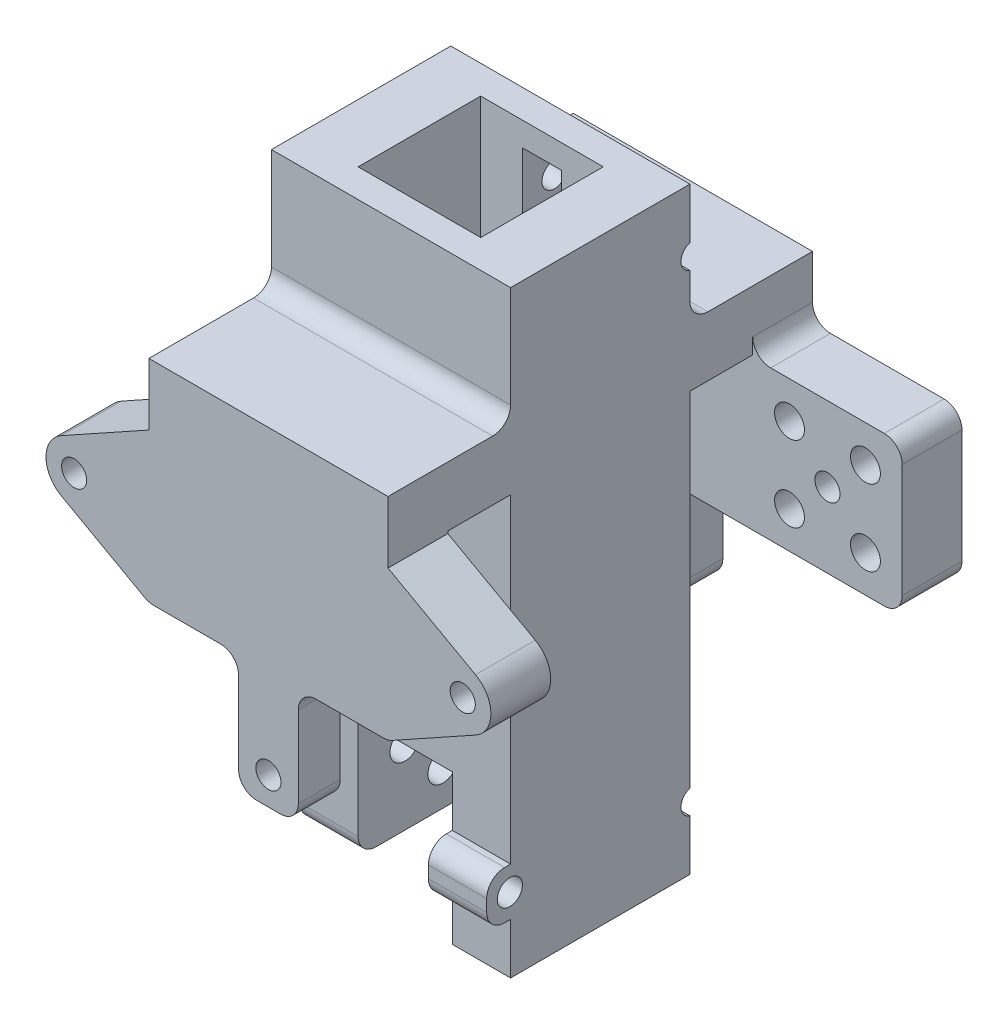
from build123d import *

# Parameters (mm, degrees)
SKETCH2_W           = 40
SKETCH2_H           = 30
BOSS_EXTRUDE1_DEPTH = 100
SKETCH3_W           = 20.5
SKETCH3_H           = 20.5
CUT_EXTRUDE1_DEPTH  = 100
SKETCH4_W           = 20.5
SKETCH4_H           = 50
CUT_EXTRUDE2_DEPTH  = 4.75
SKETCH5_W           = 4.75
SKETCH5_H           = 25
CUT_EXTRUDE4_DEPTH  = 9.75
SKETCH6_R           = 2.1
CUT_EXTRUDE5_DEPTH  = 9.75
SKETCH7_R           = 2.5
CUT_EXTRUDE6_DEPTH  = 5.18
SKETCH8_W           = 40
SKETCH8_H           = 10
BOSS_EXTRUDE2_DEPTH = 20.5
SKETCH9_W           = 40
SKETCH9_H           = 10
BOSS_EXTRUDE3_DEPTH = 45
BOSS_EXTRUDE4_START = -65
SKETCH11_W          = 10
SKETCH11_H          = 25
BOSS_EXTRUDE4_DEPTH = 90
SKETCH13_R          = 2.1
CUT_EXTRUDE7_DEPTH  = 4.57
CUT_EXTRUDE8_START  = -5.43
SKETCH14_R          = 2.1
SKETCH14_R_2        = 2.5
CUT_EXTRUDE8_DEPTH  = 5.43
SKETCH15_R          = 2.1
CUT_EXTRUDE9_DEPTH  = 10
CUT_EXTRUDE10_REACH = 132.637
SKETCH18_R          = 2.1
SKETCH19_W          = 15
SKETCH19_H          = 19.625
CUT_EXTRUDE11_DEPTH = 12.57
FILLET1_R           = 3
SKETCH20_W          = 11.314866833
SKETCH20_H          = 26.234404623
CUT_EXTRUDE12_DEPTH = 3
SKETCH22_W          = 9.75
SKETCH22_H          = 8
BOSS_EXTRUDE5_DEPTH = 4
SKETCH21_R          = 2.1
CUT_EXTRUDE13_DEPTH = 40
FILLET2_R           = 3
SKETCH23_W          = 6.5
SKETCH23_H          = 13
CUT_EXTRUDE14_DEPTH = 4.75
SKETCH25_R          = 3.1
SKETCH25_R_2        = 2.1
BOSS_EXTRUDE7_DEPTH = 4
SKETCH25_3_R        = 2.1
CUT_EXTRUDE16_DEPTH = 16.75


with BuildPart() as part:
    # Sketch2 → Boss-Extrude1 (new body)
    with BuildSketch(Plane(origin=(0, 0, 0), x_dir=(1, 0, 0), z_dir=(0, 1, 0))):
        Rectangle(SKETCH2_W, SKETCH2_H)
    extrude(amount=BOSS_EXTRUDE1_DEPTH)

    # Sketch3 → Cut-Extrude1 (cut)
    with BuildSketch(Plane(origin=(0, 0, 0), x_dir=(1, 0, 0), z_dir=(0, 1, 0))):
        Rectangle(SKETCH3_W, SKETCH3_H)
    extrude(amount=CUT_EXTRUDE1_DEPTH, mode=Mode.SUBTRACT)

    # Sketch4 → Cut-Extrude2 (cut)
    with BuildSketch(Plane.XY.offset(15)):
        Rectangle(SKETCH4_W, SKETCH4_H)
    extrude(amount=-CUT_EXTRUDE2_DEPTH, mode=Mode.SUBTRACT)

    # Sketch5 → Cut-Extrude4 (cut)
    with BuildSketch(Plane(origin=(-10.25, 0, 0), x_dir=(0, 0, -1), z_dir=(1, 0, 0))):
        with Locations((-12.625, 12.5)):
            Rectangle(SKETCH5_W, SKETCH5_H)
    extrude(amount=-CUT_EXTRUDE4_DEPTH, mode=Mode.SUBTRACT)

    # Sketch6 → Cut-Extrude5 (cut)
    with BuildSketch(Plane.ZY.offset(20)):
        with Locations((2.425, 12.5)):
            Circle(SKETCH6_R)
        with Locations((-10.275, 12.5)):
            Circle(SKETCH6_R)
        with Locations((-3.925, 18.85)):
            Circle(SKETCH6_R)
        with Locations((-3.925, 6.15)):
            Circle(SKETCH6_R)
    extrude(amount=-CUT_EXTRUDE5_DEPTH, mode=Mode.SUBTRACT)

    # Sketch7 → Cut-Extrude6 (cut)
    with BuildSketch(Plane(origin=(-10.25, 0, 0), x_dir=(0, 0, -1), z_dir=(1, 0, 0))):
        with Locations((-2.425, 12.5)):
            Circle(SKETCH7_R)
        with Locations((10.275, 12.5)):
            Circle(SKETCH7_R)
        with Locations((3.925, 18.85)):
            Circle(SKETCH7_R)
        with Locations((3.925, 6.15)):
            Circle(SKETCH7_R)
    extrude(amount=-CUT_EXTRUDE6_DEPTH, mode=Mode.SUBTRACT)

    # Sketch8 → Boss-Extrude2 (add)
    with BuildSketch(Plane(origin=(0, 0, -15), x_dir=(-1, 0, 0), z_dir=(0, 0, -1))):
        with Locations((0, 75)):
            Rectangle(SKETCH8_W, SKETCH8_H)
    boss_extrude2 = extrude(amount=BOSS_EXTRUDE2_DEPTH)

    # Sketch9 → Boss-Extrude3 (add)
    with BuildSketch(Plane.XZ.offset(-70)):
        with Locations((0, -30.5)):
            Rectangle(SKETCH9_W, SKETCH9_H)
    boss_extrude3 = extrude(amount=BOSS_EXTRUDE3_DEPTH)

    # Sketch11 → Boss-Extrude4 (add)
    with BuildSketch(Plane(origin=(20, 0, 0), x_dir=(0, 0, -1), z_dir=(1, 0, 0)).offset(BOSS_EXTRUDE4_START)):
        with Locations((30.5, 57.125)):
            Rectangle(SKETCH11_W, SKETCH11_H)
    boss_extrude4 = extrude(amount=BOSS_EXTRUDE4_DEPTH)

    # Sketch13 → Cut-Extrude7 (cut)
    with BuildSketch(Plane(origin=(0, 0, -35.5), x_dir=(-1, 0, 0), z_dir=(0, 0, -1))):
        with Locations((-32.5, 57.125)):
            Circle(SKETCH13_R)
        with Locations((-26.15, 63.475)):
            Circle(SKETCH13_R)
        with Locations((-38.85, 63.475)):
            Circle(SKETCH13_R)
        with Locations((-38.85, 50.775)):
            Circle(SKETCH13_R)
        with Locations((-26.15, 50.775)):
            Circle(SKETCH13_R)
    extrude(amount=-CUT_EXTRUDE7_DEPTH, mode=Mode.SUBTRACT)

    # Sketch14 → Cut-Extrude8 (cut)
    with BuildSketch(Plane.XY.offset(-25.5).offset(CUT_EXTRUDE8_START)):
        with Locations(Location((32.5, 57.125, 0), (0, 0, 180))):
            Circle(SKETCH14_R)
        with Locations((38.85, 63.475)):
            Circle(SKETCH14_R_2)
        with Locations((26.15, 63.475)):
            Circle(SKETCH14_R_2)
        with Locations((26.15, 50.775)):
            Circle(SKETCH14_R_2)
        with Locations((38.85, 50.775)):
            Circle(SKETCH14_R_2)
    extrude(amount=CUT_EXTRUDE8_DEPTH, mode=Mode.SUBTRACT)

    # Sketch15 → Cut-Extrude9 (cut)
    with BuildSketch(Plane(origin=(0, 0, -35.5), x_dir=(-1, 0, 0), z_dir=(0, 0, -1))):
        with Locations((32.5, 57.125)):
            Circle(SKETCH15_R)
        with Locations((0, 29.65)):
            Circle(SKETCH15_R)
        with BuildLine():
            Line((20, 69.625), (34.632584515, 61.495786381))
            ThreePointArc((34.632584515, 61.495786381), (37.204369859, 57.125), (34.632584515, 52.754213619))
            Line((34.632584515, 52.754213619), (20, 44.625))
            Line((20, 44.625), (45, 44.625))
            Line((45, 44.625), (45, 69.625))
            Line((45, 69.625), (20, 69.625))
        make_face()
    cut_extrude9 = extrude(amount=-CUT_EXTRUDE9_DEPTH, mode=Mode.SUBTRACT)

    # Mirror2: Boss-Extrude2, Boss-Extrude3, Boss-Extrude4, Cut-Extrude9 across plane
    add(boss_extrude2.mirror(Plane.XY))
    add(boss_extrude3.mirror(Plane.XY))
    add(boss_extrude4.mirror(Plane.XY))
    add(cut_extrude9.mirror(Plane.XY), mode=Mode.SUBTRACT)

    # Sketch18 → Cut-Extrude10 (cut, up to next)
    with BuildSketch(Plane.XY.offset(35.5), mode=Mode.PRIVATE) as cut_extrude10_sk1:
        with BuildLine():
            Line((20, 69.625), (34.632584515, 61.495786381))
            ThreePointArc((34.632584515, 61.495786381), (37.204369859, 57.125), (34.632584515, 52.754213619))
            Line((34.632584515, 52.754213619), (20, 44.625))
            Line((20, 44.625), (45, 44.625))
            Line((45, 44.625), (45, 69.625))
            Line((45, 69.625), (20, 69.625))
        make_face()
    cut_extrude10_tool1 = extrude(cut_extrude10_sk1.sketch, amount=-CUT_EXTRUDE10_REACH, mode=Mode.PRIVATE) & part.part
    # Sketch18 → Cut-Extrude10 (cut, up to next)
    with BuildSketch(Plane.XY.offset(35.5), mode=Mode.PRIVATE) as cut_extrude10_sk2:
        with Locations(Location((32.5, 57.125, 0), (0, 0, 180))):
            Circle(SKETCH18_R)
    cut_extrude10_tool2 = extrude(cut_extrude10_sk2.sketch, amount=-CUT_EXTRUDE10_REACH, mode=Mode.PRIVATE) & part.part
    add(cut_extrude10_tool1.solids().sort_by_distance((27.487993, 65.869454, 35.5))[0], mode=Mode.SUBTRACT)
    add(cut_extrude10_tool2.solids().sort_by_distance((32.5, 57.125, 35.5))[0], mode=Mode.SUBTRACT)

    # Sketch19 → Cut-Extrude11 (cut)
    with BuildSketch(Plane.XY.offset(35.5)):
        with Locations((-12.5, 34.8125)):
            Rectangle(SKETCH19_W, SKETCH19_H)
        with Locations((12.5, 34.8125)):
            Rectangle(SKETCH19_W, SKETCH19_H)
    cut_extrude11 = extrude(amount=-CUT_EXTRUDE11_DEPTH, mode=Mode.SUBTRACT)

    # Mirror3: Cut-Extrude11 across plane
    add(cut_extrude11.mirror(Plane.XY), mode=Mode.SUBTRACT)

    # Fillet1
    # the kernel refuses this fillet: 3 mm, written as the material it adds along each edge
    with BuildSketch(Plane(origin=(-20, 80, -15), x_dir=(0, 1, 0), z_dir=(1, 0, 0)), Plane(origin=(-20, 80, 15), x_dir=(0, 0, 1), z_dir=(1, 0, 0))) as fillet1_piece_1:
        with BuildLine():
            CenterArc((FILLET1_R, -FILLET1_R), FILLET1_R, 90, 90)
            Line((0, -FILLET1_R), (0, 0))
            Line((0, 0), (FILLET1_R, 0))
        make_face()
    extrude(amount=40)
    with BuildSketch(Plane(origin=(20, 69.625, -35.5), x_dir=(1, 0, 0), z_dir=(0, 0, 1)), Plane(origin=(-5, 44.625, 35.5), x_dir=(0, -1, 0), z_dir=(0, 0, -1)), Plane(origin=(5, 44.625, 35.5), x_dir=(1, 0, 0), z_dir=(0, 0, -1)), Plane(origin=(-5, 44.625, -35.5), x_dir=(-1, 0, 0), z_dir=(0, 0, 1)), Plane(origin=(5, 44.625, -35.5), x_dir=(0, -1, 0), z_dir=(0, 0, 1))) as fillet1_piece_2:
        with BuildLine():
            CenterArc((FILLET1_R, FILLET1_R), FILLET1_R, 180, 90)
            Line((0, FILLET1_R), (0, 0))
            Line((0, 0), (FILLET1_R, 0))
        make_face()
    extrude(amount=10)
    # the kernel refuses this fillet: 3 mm, written as the material it takes off along each edge
    with BuildSketch(Plane(origin=(-20, 44.625, -37.443445211), x_dir=(1, 0, 0), z_dir=(0, 0, 1)), Plane(origin=(-20, 44.625, 37.443445211), x_dir=(-0.8741572761215363, 0.48564293117863483, 0), z_dir=(0, 0, -1))) as fillet1_2_piece_1:
        with BuildLine():
            CenterArc((FILLET1_R * 0.259126028197, FILLET1_R), FILLET1_R, 240.945395901, 29.054604099)
            Line((-FILLET1_R * 0.226516902981, FILLET1_R * 0.125842723878), (0, 0))
            Line((0, 0), (FILLET1_R * 0.259126028197, 0))
        make_face()
    extrude(amount=13.886890423, mode=Mode.SUBTRACT)
    with BuildSketch(Plane(origin=(45, 44.625, -43), x_dir=(0, 1, 0), z_dir=(0, 0, 1)), Plane(origin=(5, 25, 43), x_dir=(-1, 0, 0), z_dir=(0, 0, -1)), Plane(origin=(-5, 25, 43), x_dir=(0, 1, 0), z_dir=(0, 0, -1)), Plane(origin=(5, 25, -43), x_dir=(0, 1, 0), z_dir=(0, 0, 1)), Plane(origin=(-5, 25, -43), x_dir=(1, 0, 0), z_dir=(0, 0, 1))) as fillet1_2_piece_2:
        with BuildLine():
            CenterArc((FILLET1_R, FILLET1_R), FILLET1_R, 180, 90)
            Line((0, FILLET1_R), (0, 0))
            Line((0, 0), (FILLET1_R, 0))
        make_face()
    extrude(amount=25, mode=Mode.SUBTRACT)
    with BuildSketch(Plane(origin=(45, 69.625, -18), x_dir=(-1, 0, 0), z_dir=(0, 0, -1))) as fillet1_2_piece_3:
        with BuildLine():
            CenterArc((FILLET1_R, -FILLET1_R), FILLET1_R, 90, 90)
            Line((0, -FILLET1_R), (0, 0))
            Line((0, 0), (FILLET1_R, 0))
        make_face()
    extrude(amount=25, mode=Mode.SUBTRACT)
    with BuildSketch(Plane(origin=(20, 44.625, 23.556554789), x_dir=(-1, 0, 0), z_dir=(0, 0, 1))) as fillet1_2_piece_4:
        with BuildLine():
            CenterArc((FILLET1_R * 0.259126028197, -FILLET1_R), FILLET1_R, 90, 29.054604099)
            Line((-FILLET1_R * 0.226516902981, -FILLET1_R * 0.125842723878), (0, 0))
            Line((0, 0), (FILLET1_R * 0.259126028197, 0))
        make_face()
    extrude(amount=13.886890423, mode=Mode.SUBTRACT)
    with BuildSketch(Plane(origin=(-2.75, 0, 10.25), x_dir=(0, 0, -1), z_dir=(-1, 0, 0))) as fillet1_2_piece_5:
        with BuildLine():
            CenterArc((FILLET1_R, -FILLET1_R), FILLET1_R, 90, 90)
            Line((0, -FILLET1_R), (0, 0))
            Line((0, 0), (FILLET1_R, 0))
        make_face()
    extrude(amount=24.75, mode=Mode.SUBTRACT)

    # Sketch20 → Cut-Extrude12 (cut)
    with BuildSketch(Plane(origin=(0, 0, 25.5), x_dir=(-1, 0, 0), z_dir=(0, 0, -1))):
        with Locations((0.657433416, 26.968821653)):
            Rectangle(SKETCH20_W, SKETCH20_H)
    cut_extrude12 = extrude(amount=-CUT_EXTRUDE12_DEPTH, mode=Mode.SUBTRACT)

    # Mirror4: Cut-Extrude12 across plane
    add(cut_extrude12.mirror(Plane.XY), mode=Mode.SUBTRACT)

    # Sketch22 → Boss-Extrude5 (add)
    with BuildSketch(Plane.XY.offset(15)):
        with Locations((15.125, 12.5)):
            Rectangle(SKETCH22_W, SKETCH22_H)
    extrude(amount=BOSS_EXTRUDE5_DEPTH)

    # Sketch21 → Cut-Extrude13 (cut)
    with BuildSketch(Plane.ZY.offset(20)):
        with Locations((15.125, 12.5)):
            Circle(SKETCH21_R)
    extrude(amount=-CUT_EXTRUDE13_DEPTH, mode=Mode.SUBTRACT)

    # Fillet2
    fillet2_edges = [part.edges().sort_by_distance(p)[0] for p in [
        (15.125, 8.5, 19),
        (15.125, 16.5, 19),
    ]]
    fillet(fillet2_edges, radius=FILLET2_R)

    # Sketch23 → Cut-Extrude14 (cut)
    with BuildSketch(Plane(origin=(0, 0, -15), x_dir=(-1, 0, 0), z_dir=(0, 0, -1))):
        with Locations((0, 89.5)):
            Rectangle(SKETCH23_W, SKETCH23_H)
        with Locations((0, 10.5)):
            Rectangle(SKETCH23_W, SKETCH23_H)
    extrude(amount=-CUT_EXTRUDE14_DEPTH, mode=Mode.SUBTRACT)

    # Sketch25 → Boss-Extrude7 (add)
    # profile 1 of 2: a face of its own
    with BuildSketch(Plane.ZY.offset(-3.25)):
        with Locations((-15.6, 89.5)):
            Circle(SKETCH25_R)
        with Locations((-15.6, 89.5)):
            Circle(SKETCH25_R_2, mode=Mode.SUBTRACT)
    # profile 2 of 2: a face of its own
    with BuildSketch(Plane.ZY.offset(-3.25)):
        with Locations((-15.6, 10.5)):
            Circle(SKETCH25_R)
        with Locations((-15.6, 10.5)):
            Circle(SKETCH25_R_2, mode=Mode.SUBTRACT)
    boss_extrude7 = extrude(amount=-BOSS_EXTRUDE7_DEPTH)

    # Sketch25<3> → Cut-Extrude16 (cut)
    with BuildSketch(Plane.ZY.offset(-3.25)):
        with Locations(Location((-15.6, 10.5, 0), (0, 0, 270))):
            Circle(SKETCH25_3_R)
        with BuildLine():
            ThreePointArc((-15, 87.48753882), (-13.916254176, 88.24500996), (-13.5, 89.5))
            ThreePointArc((-13.5, 89.5), (-13.916254176, 90.75499004), (-15, 91.51246118))
            Line((-15, 91.51246118), (-15, 87.48753882))
        make_face()
        with BuildLine():
            Line((-15, 87.48753882), (-15, 91.51246118))
            ThreePointArc((-15, 91.51246118), (-17.7, 89.5), (-15, 87.48753882))
        make_face()
    cut_extrude16 = extrude(amount=-CUT_EXTRUDE16_DEPTH, mode=Mode.SUBTRACT)

    # Mirror5: Boss-Extrude7, Cut-Extrude16 across plane
    add(boss_extrude7.mirror(Plane(origin=(0, 0, 0), x_dir=(0, 0, 1), z_dir=(1, 0, 0))))
    add(cut_extrude16.mirror(Plane(origin=(0, 0, 0), x_dir=(0, 0, 1), z_dir=(1, 0, 0))), mode=Mode.SUBTRACT)


solid = part.part
